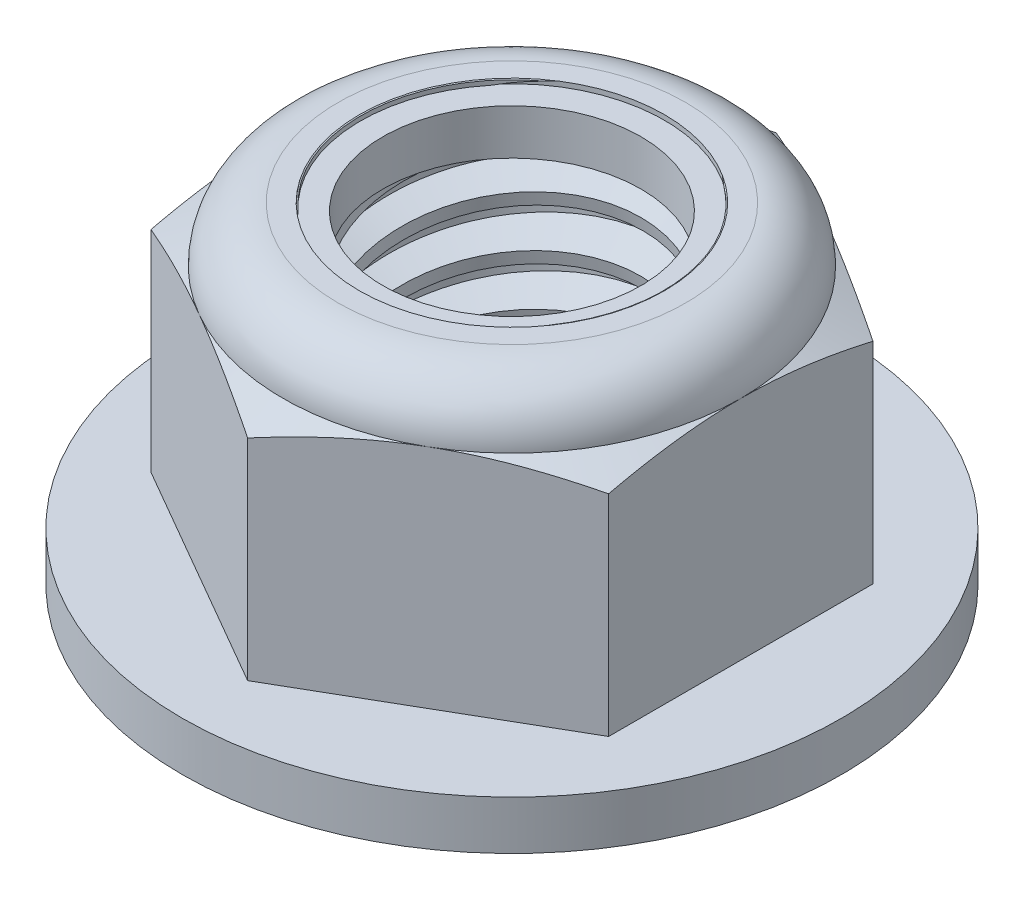
from build123d import *

# Parameters (mm, degrees)
EXTRUDE1_DEPTH       = 10.31875
SKETCH8_W            = 10.287
SKETCH8_H            = 1.524
SKETCH2_W            = 4.7625
SKETCH2_H            = 10.31875
LPATTERN1_COUNT      = 7
LPATTERN1_PITCH      = 1.5875
LPATTERN1_COUNT_DIR2 = 2
LPATTERN1_PITCH_DIR2 = 1.5875


with BuildPart() as part:
    # Sketch1 → Extrude1 (new body)
    with BuildSketch(Plane(origin=(0, 0, 0), x_dir=(1, 0, 0), z_dir=(0, 1, 0))):
        Polygon((0, 8.248891971), (-7.14375, 4.124445986), (-7.14375, -4.124445986), (0, -8.248891971), (7.14375, -4.124445986), (7.14375, 4.124445986), align=None)
    extrude(amount=EXTRUDE1_DEPTH)

    # Sketch8 → Revolve3 (revolve)
    with BuildSketch(Plane(origin=(0, 0, 0), x_dir=(0, 0, -1), z_dir=(1, 0, 0))):
        with Locations((5.1435, 0.762)):
            Rectangle(SKETCH8_W, SKETCH8_H)
    revolve(axis=Axis((0, 0, 0), (0, -1, 0)))

    # Sketch4 → Cut-Revolve2 (revolve, cut)
    with BuildSketch(Plane(origin=(0, 0, 0), x_dir=(0, 0, -1), z_dir=(1, 0, 0))):
        Polygon((0, 10.31875), (4.7625, 10.31875), (4.029111805, 9.976765468), (4.029111805, 0.341984532), (4.7625, 0), (0, 0), align=None)
    revolve(axis=Axis((0, 10.31875, 0), (0, 1, 0)), mode=Mode.SUBTRACT)


with BuildPart() as body_2:
    # Sketch2 → Revolve1 (revolve)
    with BuildSketch(Plane(origin=(0, 0, 0), x_dir=(0, 0, -1), z_dir=(1, 0, 0))):
        with Locations((2.38125, 5.159375)):
            Rectangle(SKETCH2_W, SKETCH2_H)
    revolve(axis=Axis((0, -4.7625, 0), (0, 1, 0)))

    # Sketch3 → Cut-Revolve1 (revolve, cut)
    with BuildSketch(Plane(origin=(0, 0, 0), x_dir=(0, 0, -1), z_dir=(1, 0, 0))):
        Polygon((4.795122924, 10.123012456), (5.023483392, 8.752849646), (4.094357653, 9.100932102), (4.029111805, 9.49240719), align=None)
    cut_revolve1 = revolve(axis=Axis((0, 10.31875, 0.28317269), (0, -0.9863939238321436, -0.1643989873053577)), mode=Mode.SUBTRACT)

    # LPattern1: Cut-Revolve1 7 × 2
    with Locations(*[Vector(0, -1, 0) * (i * LPATTERN1_PITCH) + Vector(0, 1, 0) * (j * LPATTERN1_PITCH_DIR2) for i in range(LPATTERN1_COUNT) for j in range(LPATTERN1_COUNT_DIR2) if (i, j) != (0, 0)]):
        add(cut_revolve1, mode=Mode.SUBTRACT)


with BuildPart() as part_1:
    add(part.part)

    # Combine1: cut body 2
    add(body_2.part, mode=Mode.SUBTRACT)

    # Sketch5 → Cut-Revolve3 (revolve, cut)
    with BuildSketch(Plane(origin=(0, 0, 0), x_dir=(0, 0, -1), z_dir=(1, 0, 0))):
        with BuildLine():
            Line((8.248891971, 1.524), (8.248891971, 8.083622169))
            Line((8.248891971, 8.083622169), (7.14375, 8.598958333))
            ThreePointArc((7.14375, 8.598958333), (6.640034683, 9.815034683), (5.423958333, 10.31875))
            Line((5.423958333, 10.31875), (5.423958333, 11.58875))
            Line((5.423958333, 11.58875), (9.518891971, 11.58875))
            Line((9.518891971, 11.58875), (9.518891971, 1.524))
            Line((9.518891971, 1.524), (8.248891971, 1.524))
        make_face()
    revolve(axis=Axis((0, 0, 0), (0, 1, 0)), mode=Mode.SUBTRACT)

    # Sketch6 → Cut-Revolve4 (revolve, cut)
    with BuildSketch(Plane(origin=(0, 0, 0), x_dir=(0, 0, -1), z_dir=(1, 0, 0))):
        with BuildLine():
            Line((0, 8.598958333), (6.99135, 8.598958333))
            ThreePointArc((6.99135, 8.598958333), (6.53227161, 9.70727161), (5.423958333, 10.16635))
            Line((5.423958333, 10.16635), (4.726535069, 10.16635))
            Line((4.726535069, 10.16635), (4.726535069, 11.58875))
            Line((4.726535069, 11.58875), (0, 11.58875))
            Line((0, 11.58875), (0, 8.598958333))
        make_face()
    revolve(axis=Axis((0, 11.58875, 0), (0, 1, 0)), mode=Mode.SUBTRACT)


with BuildPart() as body_2_2:
    # Sketch7 → Revolve2 (revolve)
    with BuildSketch(Plane(origin=(0, 0, 0), x_dir=(0, 0, -1), z_dir=(1, 0, 0))):
        with BuildLine():
            Line((4.029111805, 8.675158333), (6.913201815, 8.675158333))
            ThreePointArc((6.913201815, 8.675158333), (6.451096051, 9.679995195), (5.423958333, 10.09015))
            Line((5.423958333, 10.09015), (4.029111805, 10.09015))
            Line((4.029111805, 10.09015), (4.029111805, 8.675158333))
        make_face()
    revolve(axis=Axis((0, 8.675158333, 0), (0, 1, 0)))


solid = Compound([part_1.part, body_2_2.part])
